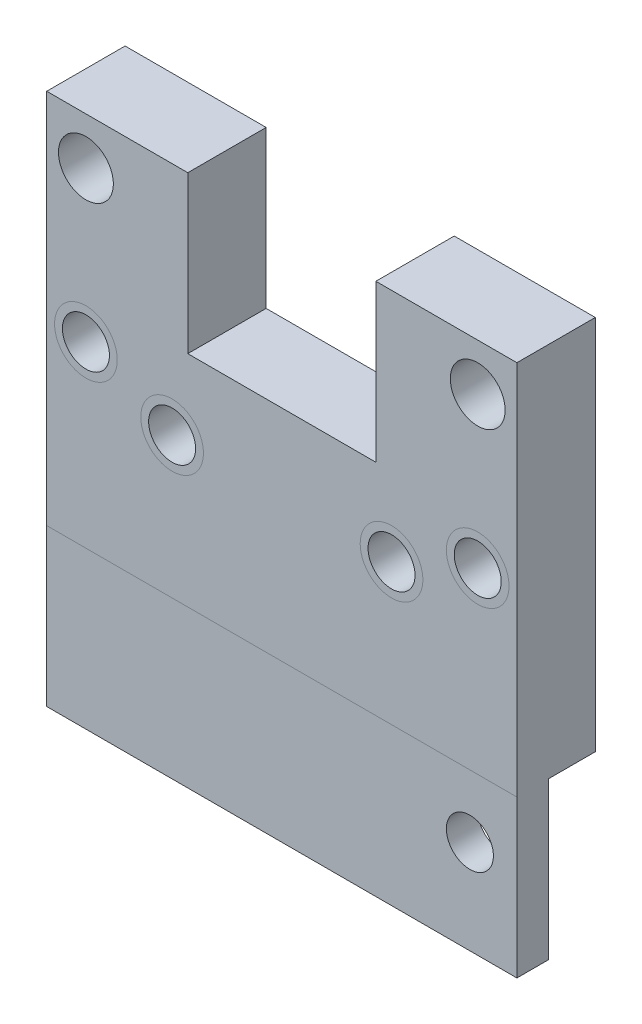
from build123d import *

# Parameters (mm, degrees)
RESSALTO_EXTRUS_O2_OUTLINE_W = 30
RESSALTO_EXTRUS_O2_OUTLINE_H = 24
RESSALTO_EXTRUS_O2_OUTLINE_R = 1.5
RESSALTO_EXTRUS_O2_DEPTH     = 3
ESBO_O5_W                    = 30
ESBO_O5_H                    = 10
CORTE_EXTRUS_O2_DEPTH        = 1
RESSALTO_EXTRUS_O3_START     = -3.000012
ESBO_O6_R                    = 2
ESBO_O6_R_2                  = 1.75
RESSALTO_EXTRUS_O3_DEPTH     = 5.000012


# Read off the part's stored shape, not the designer's step: Ressalto-extrusão2
with BuildPart() as part:
    # Ressalto-extrusão2 outline → Ressalto-extrusão2 (new body)
    with BuildSketch(Plane.XY):
        with Locations((0, 10.5)):
            Rectangle(RESSALTO_EXTRUS_O2_OUTLINE_W, RESSALTO_EXTRUS_O2_OUTLINE_H)
        with Locations((12, 4.5)):
            Circle(RESSALTO_EXTRUS_O2_OUTLINE_R, mode=Mode.SUBTRACT)
        with Locations((-12.5, 19.897915762)):
            Circle(RESSALTO_EXTRUS_O2_OUTLINE_R, mode=Mode.SUBTRACT)
        with Locations((-7, 17.5)):
            Circle(RESSALTO_EXTRUS_O2_OUTLINE_R, mode=Mode.SUBTRACT)
        with Locations((7, 17.5)):
            Circle(RESSALTO_EXTRUS_O2_OUTLINE_R, mode=Mode.SUBTRACT)
        with Locations((12.5, 19.897915762)):
            Circle(RESSALTO_EXTRUS_O2_OUTLINE_R, mode=Mode.SUBTRACT)
    extrude(amount=RESSALTO_EXTRUS_O2_DEPTH)

    # Esboço5 → Corte-extrusão2 (cut)
    with BuildSketch(Plane(origin=(0, 0, 0), x_dir=(-1, 0, 0), z_dir=(0, 0, -1))):
        with Locations((0, 3.5)):
            Rectangle(ESBO_O5_W, ESBO_O5_H)
    extrude(amount=-CORTE_EXTRUS_O2_DEPTH, mode=Mode.SUBTRACT)

    # Esboço6 → Ressalto-extrusão3 (add)
    with BuildSketch(Plane(origin=(0, 0, 0), x_dir=(-1, 0, 0), z_dir=(0, 0, -1)).offset(RESSALTO_EXTRUS_O3_START)):
        Polygon((-15, 8.5), (15, 8.5), (15, 32.5), (6, 32.5), (6, 22.5), (-6, 22.5), (-6, 32.5), (-15, 32.5), align=None)
        with Locations((12.5, 19.897915762)):
            Circle(ESBO_O6_R, mode=Mode.SUBTRACT)
        with Locations((7, 17.5)):
            Circle(ESBO_O6_R, mode=Mode.SUBTRACT)
        with Locations((-7, 17.5)):
            Circle(ESBO_O6_R, mode=Mode.SUBTRACT)
        with Locations((-12.5, 19.897915762)):
            Circle(ESBO_O6_R, mode=Mode.SUBTRACT)
        with Locations((-12.5, 29.5)):
            Circle(ESBO_O6_R_2, mode=Mode.SUBTRACT)
        with Locations((12.5, 29.5)):
            Circle(ESBO_O6_R_2, mode=Mode.SUBTRACT)
    extrude(amount=RESSALTO_EXTRUS_O3_DEPTH)


solid = part.part
